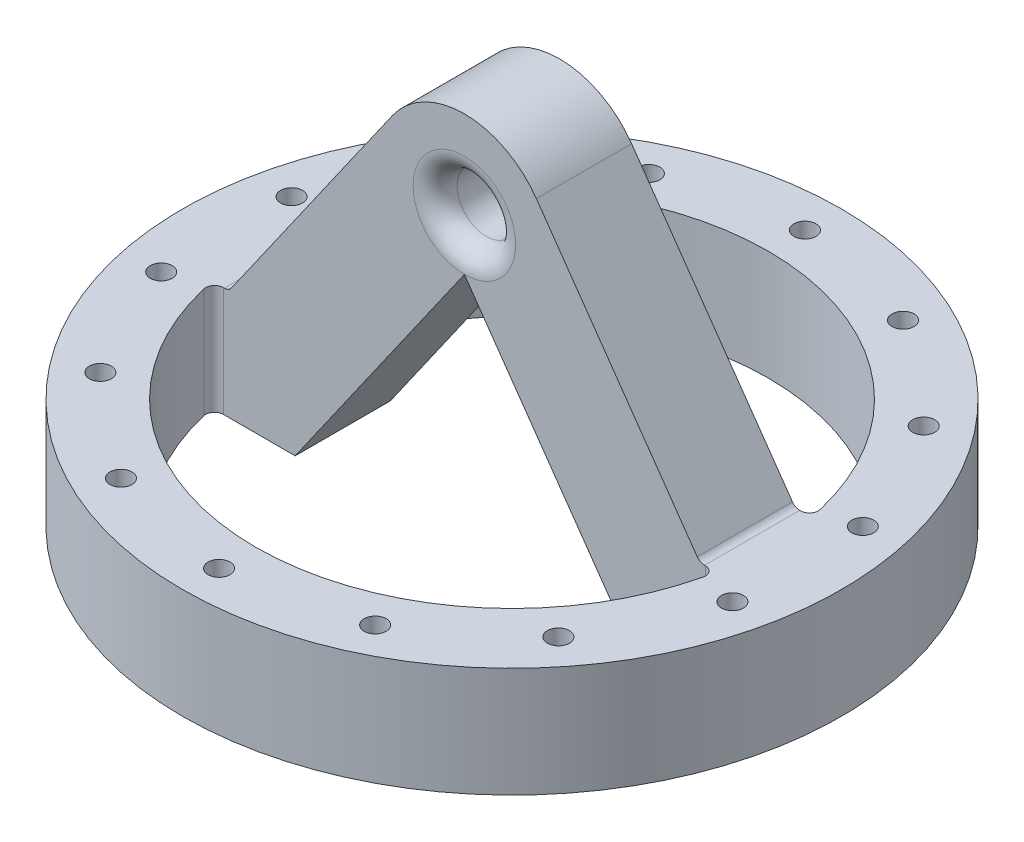
from build123d import *

# Parameters (mm, degrees)
SKETCH_1_R      = 45
SKETCH_1_R_2    = 35
SKETCH_1_R_3    = 1.5
EXTRUDE_1_DEPTH = 15
SKETCH_2_R      = 4
EXTRUDE_2_DEPTH = 6.5
FILLET_1_R      = 1.2
FILLET_2_R      = 3


with BuildPart() as part:
    # Эскиз1 → Бобышка-Вытянуть1 (new body)
    with BuildSketch(Plane(origin=(0, 0, 0), x_dir=(1, 0, 0), z_dir=(0, 1, 0))):
        with Locations(Location((0, 0, 0), (0, 0, 270))):
            Circle(SKETCH_1_R)
        with Locations(Location((0, 0, 0), (0, 0, 270))):
            Circle(SKETCH_1_R_2, mode=Mode.SUBTRACT)
        with Locations(Location((0, 40, 0), (0, 0, 270))):
            Circle(SKETCH_1_R_3, mode=Mode.SUBTRACT)
        with Locations(Location((17.355349565, 36.038754716, 0), (0, 0, 270))):
            Circle(SKETCH_1_R_3, mode=Mode.SUBTRACT)
        with Locations(Location((31.273259299, 24.939592074, 0), (0, 0, 270))):
            Circle(SKETCH_1_R_3, mode=Mode.SUBTRACT)
        with Locations(Location((38.997116487, 8.900837358, 0), (0, 0, 270))):
            Circle(SKETCH_1_R_3, mode=Mode.SUBTRACT)
        with Locations(Location((38.997116487, -8.900837358, 0), (0, 0, 270))):
            Circle(SKETCH_1_R_3, mode=Mode.SUBTRACT)
        with Locations(Location((31.273259299, -24.939592074, 0), (0, 0, 270))):
            Circle(SKETCH_1_R_3, mode=Mode.SUBTRACT)
        with Locations(Location((17.355349565, -36.038754716, 0), (0, 0, 270))):
            Circle(SKETCH_1_R_3, mode=Mode.SUBTRACT)
        with Locations(Location((0, -40, 0), (0, 0, 270))):
            Circle(SKETCH_1_R_3, mode=Mode.SUBTRACT)
        with Locations(Location((-17.355349565, -36.038754716, 0), (0, 0, 270))):
            Circle(SKETCH_1_R_3, mode=Mode.SUBTRACT)
        with Locations(Location((-31.273259299, -24.939592074, 0), (0, 0, 270))):
            Circle(SKETCH_1_R_3, mode=Mode.SUBTRACT)
        with Locations(Location((-38.997116487, -8.900837358, 0), (0, 0, 270))):
            Circle(SKETCH_1_R_3, mode=Mode.SUBTRACT)
        with Locations(Location((-38.997116487, 8.900837358, 0), (0, 0, 270))):
            Circle(SKETCH_1_R_3, mode=Mode.SUBTRACT)
        with Locations(Location((-31.273259299, 24.939592074, 0), (0, 0, 270))):
            Circle(SKETCH_1_R_3, mode=Mode.SUBTRACT)
        with Locations(Location((-17.355349565, 36.038754716, 0), (0, 0, 270))):
            Circle(SKETCH_1_R_3, mode=Mode.SUBTRACT)
    extrude(amount=EXTRUDE_1_DEPTH)

    # Эскиз2 → Бобышка-Вытянуть2 (add, symmetric)
    with BuildSketch(Plane.XY):
        with BuildLine():
            Line((-36, 0), (-23.106848761, 0))
            Line((-23.106848761, 0), (0, 33))
            Line((0, 33), (23.106848761, 0))
            Line((23.106848761, 0), (36, 0))
            Line((36, 0), (36, 15))
            Line((36, 15), (32.15448352, 15))
            Line((32.15448352, 15), (9.829824531, 46.882917236))
            ThreePointArc((9.829824531, 46.882917236), (0, 52), (-9.829824531, 46.882917236))
            Line((-9.829824531, 46.882917236), (-32.15448352, 15))
            Line((-32.15448352, 15), (-36, 15))
            Line((-36, 15), (-36, 0))
        make_face()
        with Locations(Location((0, 40, 0), (0, 0, 180))):
            Circle(SKETCH_2_R, mode=Mode.SUBTRACT)
    extrude(amount=EXTRUDE_2_DEPTH, both=True)

    # Скругление1
    fillet_1_edges = [part.edges().sort_by_distance(p)[0] for p in [
        (-34.391132578, 7.5, -6.5),
        (34.391132578, 7.5, -6.5),
        (-34.391132578, 7.5, 6.5),
        (34.391132578, 7.5, 6.5),
        (-32.15448352, 15, 0),
        (32.15448352, 15, 0),
    ]]
    fillet(fillet_1_edges, radius=FILLET_1_R)

    # Скругление2
    fillet_2_edges = [part.edges().sort_by_distance(p)[0] for p in [
        (4, 40, -6.5),
        (4, 40, 6.5),
    ]]
    fillet(fillet_2_edges, radius=FILLET_2_R - 0.0001)  # a hair under: the kernel refuses the full size


solid = part.part
